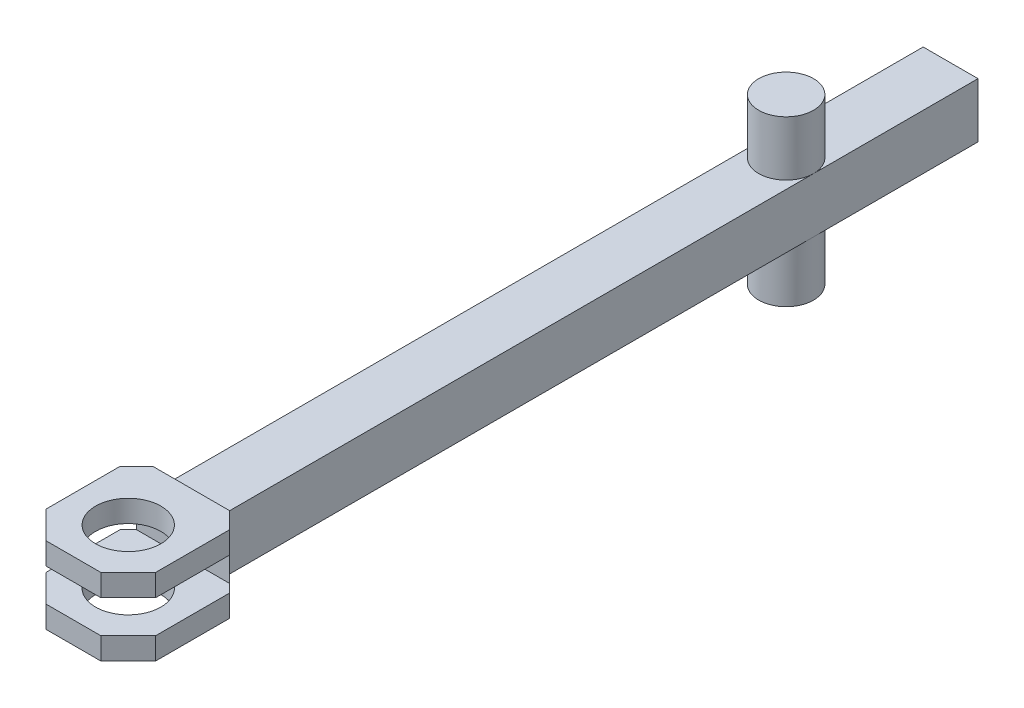
from build123d import *

# Parameters (mm, degrees)
SKETCH1_W                = 100
SKETCH1_H                = 100
BOSS_EXTRUDE1_DEPTH      = 1600
BOSS_EXTRUDE2_DEPTH      = 100
BOSS_EXTRUDE2_DEPTH_BACK = 200
SKETCH2_R                = 50
BOSS_EXTRUDE3_DEPTH      = 20
BOSS_EXTRUDE3_DEPTH_BACK = 120
SKETCH4_W                = 200
SKETCH4_H                = 234.974329415
CHAMFER1_SIZE            = 20
CHAMFER2_SIZE            = 50
SKETCH5_R                = 59.582841924
CUT_EXTRUDE2_DEPTH       = 560
SKETCH6_W                = 449.686922891
SKETCH6_H                = 60
CUT_EXTRUDE3_DEPTH       = 200


with BuildPart() as part:
    # Sketch1 → Boss-Extrude1 (new body)
    with BuildSketch(Plane.XY):
        with Locations((50, -50)):
            Rectangle(SKETCH1_W, SKETCH1_H)
    extrude(amount=BOSS_EXTRUDE1_DEPTH)

    # Sketch2 → Boss-Extrude2 (add, two sides: drawn at the far end of the back side and taken through both)
    with BuildSketch(Plane.XZ.offset(100).offset(-BOSS_EXTRUDE2_DEPTH_BACK)):
        with Locations(Location((50, 300, 0), (0, 0, 270))):
            Circle(SKETCH2_R)
    extrude(amount=BOSS_EXTRUDE2_DEPTH + BOSS_EXTRUDE2_DEPTH_BACK)

    # Sketch4 → Boss-Extrude3 (add, two sides: drawn at the far end of the back side and taken through both)
    with BuildSketch(Plane(origin=(0, 0, 0), x_dir=(1, 0, 0), z_dir=(0, 1, 0)).offset(-BOSS_EXTRUDE3_DEPTH_BACK)):
        with Locations((50, -1482.512835293)):
            Rectangle(SKETCH4_W, SKETCH4_H)
    extrude(amount=BOSS_EXTRUDE3_DEPTH + BOSS_EXTRUDE3_DEPTH_BACK)

    # Chamfer1
    chamfer1_edges = [part.edges().sort_by_distance(p)[0] for p in [
        (50, -120, 1365.025670585),
        (50, 20, 1365.025670585),
    ]]
    chamfer(chamfer1_edges, length=CHAMFER1_SIZE - 0.0001)  # a hair under: the kernel refuses the full size

    # Chamfer2
    chamfer2_edges = [part.edges().sort_by_distance(p)[0] for p in [
        (150, -50, 1365.025670585),
        (-50, -50, 1365.025670585),
        (150, -50, 1600),
        (-50, -50, 1600),
    ]]
    chamfer(chamfer2_edges, length=CHAMFER2_SIZE - 0.0001)  # a hair under: the kernel refuses the full size

    # Sketch5 → Cut-Extrude2 (cut)
    with BuildSketch(Plane.XZ.offset(120)):
        with Locations(Location((50, 1500, 0), (0, 0, 270))):
            Circle(SKETCH5_R)
    extrude(amount=-CUT_EXTRUDE2_DEPTH, mode=Mode.SUBTRACT)

    # Sketch6 → Cut-Extrude3 (cut)
    with BuildSketch(Plane.XY.offset(1600)):
        with Locations((52.387718175, -50)):
            Rectangle(SKETCH6_W, SKETCH6_H)
    extrude(amount=-CUT_EXTRUDE3_DEPTH, mode=Mode.SUBTRACT)


solid = part.part
